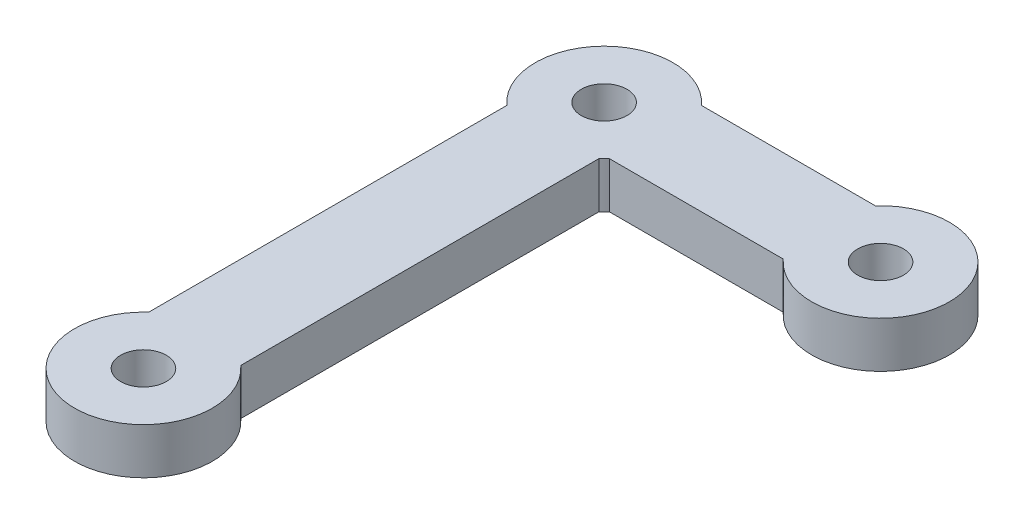
from build123d import *

# Parameters (mm, degrees)
LIFT_ARM_START         = -18.881702924
LIFT_ARM_OUTLINE_R     = 1.575
LIFT_ARM_DEPTH         = 3.175
LIFT_ARM_SKETCH_R      = 1.575
LIFT_ARM_EXTRUDE_DEPTH = 3.175


# Read off the part's stored shape, not the designer's step: Lift_Arm
with BuildPart() as part:
    # Lift_Arm outline → Lift_Arm (new body)
    with BuildSketch(Plane(origin=(0, 0, 0), x_dir=(1, 0, 0), z_dir=(0, 1, 0)).offset(LIFT_ARM_START)):
        with BuildLine():
            ThreePointArc((-35.433976258, -25.480614034), (-32.258976258, -33.763583748), (-29.083976258, -25.480614034))
            Line((-29.083976258, -25.480614034), (-29.083976258, -0.796553462))
            ThreePointArc((-29.083976258, -0.796553462), (-32.258976258, 7.486416252), (-35.433976258, -0.796553462))
            Line((-35.433976258, -0.796553462), (-35.433976258, -25.480614034))
        make_face()
        with Locations((-32.258976258, -29.013583748)):
            Circle(LIFT_ARM_OUTLINE_R, mode=Mode.SUBTRACT)
        with Locations((-32.258976258, 2.736416252)):
            Circle(LIFT_ARM_OUTLINE_R, mode=Mode.SUBTRACT)
    extrude(amount=LIFT_ARM_DEPTH)

    # Lift Arm Sketch → Lift Arm Extrude (add)
    with BuildSketch(Plane.XZ.offset(18.881702924)):
        with BuildLine():
            ThreePointArc((-28.726006544, 0.438583748), (-27.508976258, -2.736416252), (-28.726006544, -5.911416252))
            Line((-28.726006544, -5.911416252), (-16.741945972, -5.911416252))
            ThreePointArc((-16.741945972, -5.911416252), (-8.458976258, -2.736416252), (-16.741945972, 0.438583748))
            Line((-16.741945972, 0.438583748), (-28.726006544, 0.438583748))
        make_face()
        with Locations(Location((-13.208976258, -2.736416252, 0), (0, 0, 270))):
            Circle(LIFT_ARM_SKETCH_R, mode=Mode.SUBTRACT)
    extrude(amount=-LIFT_ARM_EXTRUDE_DEPTH)


solid = part.part
